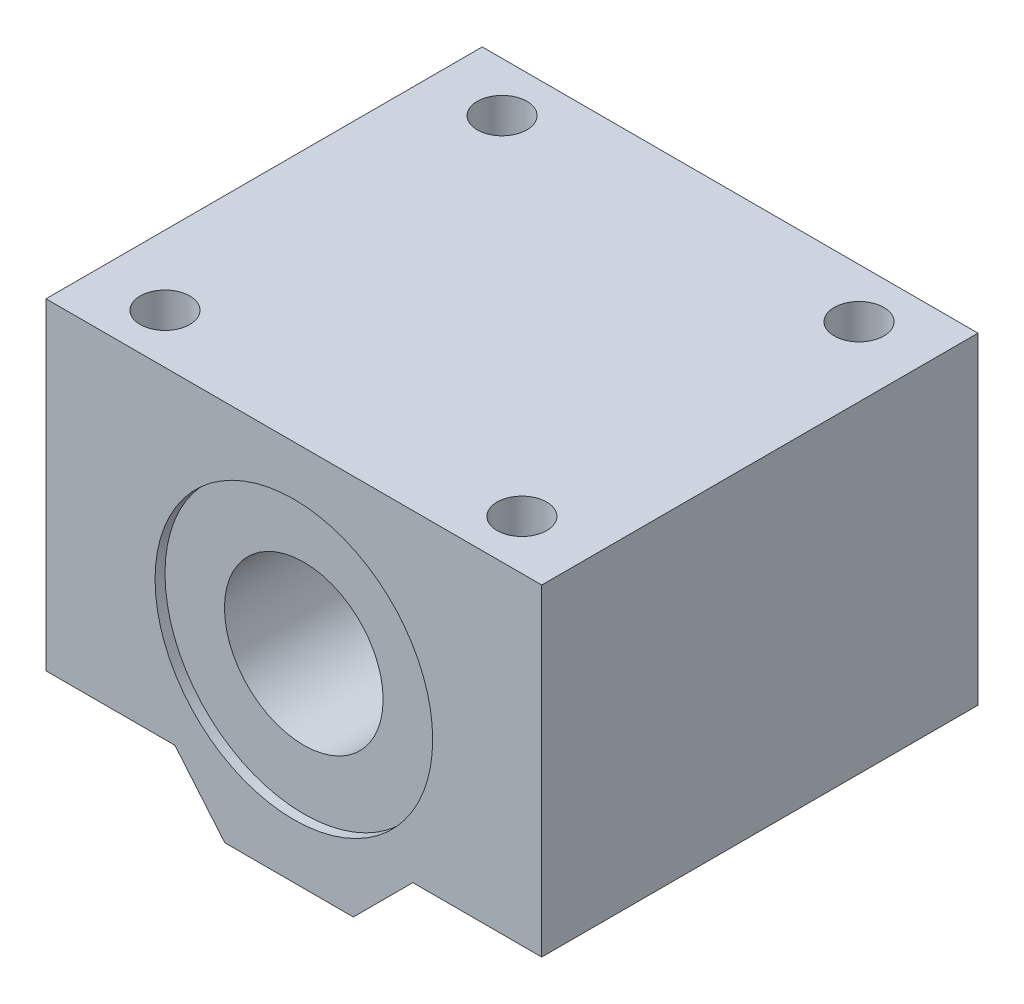
from build123d import *

# Parameters (mm, degrees)
SKETCH1_W           = 50
SKETCH1_H           = 38.5
SKETCH1_R           = 8
BOSS_EXTRUDE1_DEPTH = 22
CUT_EXTRUDE5_DEPTH  = 55.143905474
SKETCH2_R           = 2.15
CUT_EXTRUDE1_DEPTH  = 51.904322017
SKETCH3_R           = 2.5
CUT_EXTRUDE2_DEPTH  = 12
SKETCH4_R           = 14
CUT_EXTRUDE3_DEPTH  = 1
CUT_EXTRUDE4_START  = -1
SKETCH5_R           = 14
CUT_EXTRUDE4_DEPTH  = 1


with BuildPart() as part:
    # Sketch1 → Boss-Extrude1 (new, symmetric)
    with BuildSketch(Plane.XY):
        Rectangle(SKETCH1_W, SKETCH1_H)
        with Locations((0, 0.25)):
            Circle(SKETCH1_R, mode=Mode.SUBTRACT)
    extrude(amount=BOSS_EXTRUDE1_DEPTH, both=True)

    # Sketch6 → Cut-Extrude5 (cut, through all)
    with BuildSketch(Plane.XY.offset(22)):
        Polygon((-25, -13.25), (-12, -13.25), (-6.965402213, -19.25), (-25, -19.25), align=None)
        Polygon((25, -13.25), (12, -13.25), (6, -19.25), (25, -19.25), align=None)
    extrude(amount=-CUT_EXTRUDE5_DEPTH, mode=Mode.SUBTRACT)

    # Sketch2 → Cut-Extrude1 (cut, through all)
    with BuildSketch(Plane(origin=(0, 19.25, 0), x_dir=(-1, 0, 0), z_dir=(0, -1, 0))):
        with Locations((18, -17)):
            Circle(SKETCH2_R)
        with Locations((-18, -17)):
            Circle(SKETCH2_R)
        with Locations((-18, 17)):
            Circle(SKETCH2_R)
        with Locations((18, 17)):
            Circle(SKETCH2_R)
    extrude(amount=CUT_EXTRUDE1_DEPTH, mode=Mode.SUBTRACT)

    # Sketch3 → Cut-Extrude2 (cut)
    with BuildSketch(Plane.XZ.offset(-19.25)):
        with Locations((-18, 17)):
            Circle(SKETCH3_R)
        with Locations((18, 17)):
            Circle(SKETCH3_R)
        with Locations((18, -17)):
            Circle(SKETCH3_R)
        with Locations((-18, -17)):
            Circle(SKETCH3_R)
    extrude(amount=CUT_EXTRUDE2_DEPTH, mode=Mode.SUBTRACT)

    # Sketch4 → Cut-Extrude3 (cut)
    with BuildSketch(Plane.XY.offset(22)):
        with Locations((0, 0.25)):
            Circle(SKETCH4_R)
    extrude(amount=-CUT_EXTRUDE3_DEPTH, mode=Mode.SUBTRACT)

    # Sketch5 → Cut-Extrude4 (cut)
    with BuildSketch(Plane(origin=(0, 0, -22), x_dir=(-1, 0, 0), z_dir=(0, 0, -1)).offset(CUT_EXTRUDE4_START)):
        with Locations((0, 0.25)):
            Circle(SKETCH5_R)
    extrude(amount=CUT_EXTRUDE4_DEPTH, mode=Mode.SUBTRACT)


solid = part.part
